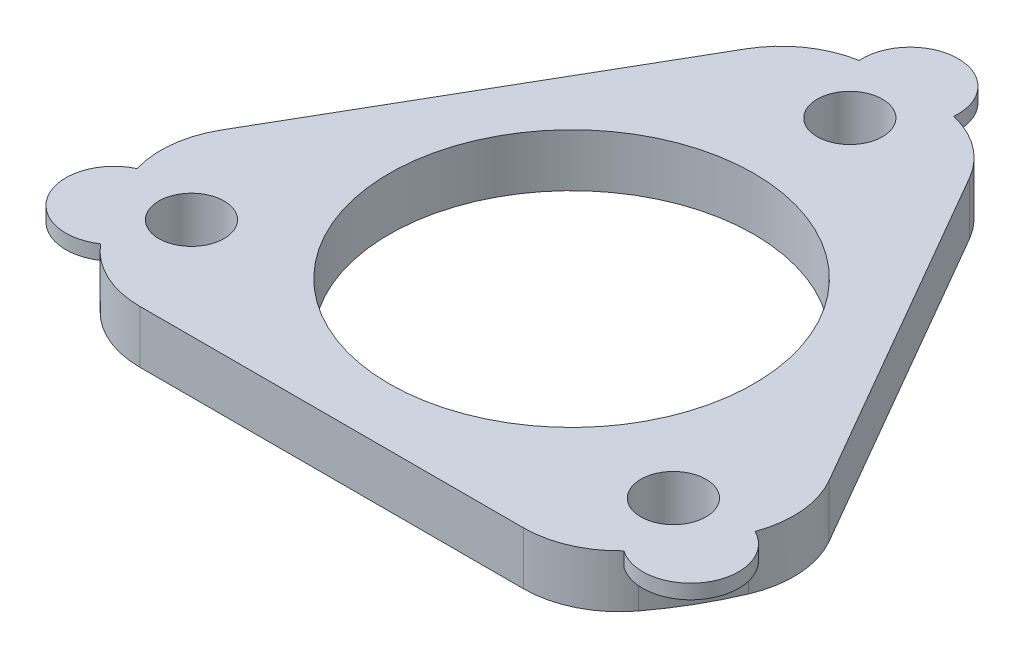
from build123d import *

# Parameters (mm, degrees)
SKETCH1_R                = 17.5
BOSS_EXTRUDE1_DEPTH      = 5.5
SKETCH2_R                = 35
SKETCH2_R_2              = 17.5
SKETCH2_R_3              = 2.8
BOSS_EXTRUDE2_DEPTH      = 5.5
BOSS_EXTRUDE3_DEPTH      = 2
BOSS_EXTRUDE3_DEPTH_BACK = 5.5
SKETCH4_R                = 2.9
SKETCH5_R                = 5
BOSS_EXTRUDE4_DEPTH      = 1.5
SKETCH3_R                = 17.5
CUT_EXTRUDE1_DEPTH       = 10
SKETCH12_R               = 72.135852014
CUT_EXTRUDE2_DEPTH       = 22
FILLET1_R                = 10
SKETCH13_R               = 3.4
CUT_EXTRUDE3_DEPTH       = 10
SKETCH14_R               = 19
CUT_EXTRUDE4_DEPTH       = 10


with BuildPart() as part:
    # Sketch1 → Boss-Extrude1 (new body)
    with BuildSketch(Plane(origin=(0, 0, 0), x_dir=(1, 0, 0), z_dir=(0, 1, 0))):
        with Locations(Location((0, 0, 0), (0, 0, 270))):
            Circle(SKETCH1_R)
    extrude(amount=BOSS_EXTRUDE1_DEPTH)

    # Sketch2 → Boss-Extrude2 (add)
    with BuildSketch(Plane(origin=(0, 0, 0), x_dir=(1, 0, 0), z_dir=(0, 1, 0))):
        with Locations(Location((0, 0, 0), (0, 0, 270))):
            Circle(SKETCH2_R)
        Circle(SKETCH2_R_2, mode=Mode.SUBTRACT)
        with Locations(Location((0, 29, 0), (0, 0, 270))):
            Circle(SKETCH2_R_3, mode=Mode.SUBTRACT)
        with Locations(Location((25.11473671, -14.5, 0), (0, 0, 270))):
            Circle(SKETCH2_R_3, mode=Mode.SUBTRACT)
        with Locations(Location((-25.11473671, -14.5, 0), (0, 0, 270))):
            Circle(SKETCH2_R_3, mode=Mode.SUBTRACT)
    extrude(amount=BOSS_EXTRUDE2_DEPTH)

    # Sketch4 → Boss-Extrude3 (add, two sides: drawn at the far end of the back side and taken through both)
    with BuildSketch(Plane.XZ.offset(-BOSS_EXTRUDE3_DEPTH_BACK)):
        with Locations(Location((-25.11473671, 14.5, 0), (0, 0, 270))):
            Circle(SKETCH4_R)
        with Locations(Location((25.11473671, 14.5, 0), (0, 0, 270))):
            Circle(SKETCH4_R)
        with Locations(Location((0, -29, 0), (0, 0, 270))):
            Circle(SKETCH4_R)
    extrude(amount=BOSS_EXTRUDE3_DEPTH + BOSS_EXTRUDE3_DEPTH_BACK)

    # Sketch5 → Boss-Extrude4 (add)
    with BuildSketch(Plane(origin=(0, 5.5, 0), x_dir=(1, 0, 0), z_dir=(0, 1, 0))):
        with Locations((-30.453629482, -17.250404383)):
            Circle(SKETCH5_R)
        with Locations((0.28752632, 34.99881896)):
            Circle(SKETCH5_R)
        with Locations((30.166103162, -17.748414577)):
            Circle(SKETCH5_R)
    extrude(amount=-BOSS_EXTRUDE4_DEPTH)

    # Sketch3 → Cut-Extrude1 (cut)
    with BuildSketch(Plane(origin=(0, 5.5, 0), x_dir=(1, 0, 0), z_dir=(0, 1, 0))):
        with Locations(Location((0, 0, 0), (0, 0, 270))):
            Circle(SKETCH3_R)
    extrude(amount=-CUT_EXTRUDE1_DEPTH, mode=Mode.SUBTRACT)

    # Sketch12 → Cut-Extrude2 (cut)
    with BuildSketch(Plane(origin=(0, 5.5, 0), x_dir=(1, 0, 0), z_dir=(0, 1, 0))):
        Circle(SKETCH12_R)
        Polygon((0, 50), (-43.301270189, -25), (43.301270189, -25), align=None, mode=Mode.SUBTRACT)
    extrude(amount=-CUT_EXTRUDE2_DEPTH, mode=Mode.SUBTRACT)

    # Fillet1
    # the kernel refuses this fillet: 10 mm, written as the material it takes off along each edge
    with BuildSketch(Plane(origin=(-24.494897428, 18.7960859, 25), x_dir=(1, 0, 0), z_dir=(0, -1, 0))) as fillet1_piece_1_section:
        with BuildLine():
            CenterArc((4.494897428, -10), FILLET1_R, 90, 53.130102354)
            ThreePointArc((-3.505102572, -4), (-1.828638885, -1.933326291), (0, 0))
            Line((0, 0), (4.494897428, 0))
        make_face()
    fillet1_piece_1 = extrude(amount=32.0921718, mode=Mode.PRIVATE)
    fillet1_piece_1 = fillet1_piece_1 - Plane(origin=(-30.453629482, 4.75, 17.250404383), x_dir=(1, 0, 0), z_dir=(0, 1, 0)) * Cylinder(5, 83, mode=Mode.PRIVATE)
    add(fillet1_piece_1, mode=Mode.SUBTRACT)
    with BuildSketch(Plane(origin=(-24.494897428, 18.7960859, 25), x_dir=(1, 0, 0), z_dir=(0, -1, 0))) as fillet1_piece_2_section:
        with BuildLine():
            CenterArc((4.494897428, -10), FILLET1_R, 90, 53.130102354)
            ThreePointArc((-3.505102572, -4), (-1.828638885, -1.933326291), (0, 0))
            Line((0, 0), (4.494897428, 0))
        make_face()
    fillet1_piece_2 = extrude(amount=32.0921718, mode=Mode.PRIVATE)
    fillet1_piece_2 = split(fillet1_piece_2, bisect_by=Plane(origin=(-27.761621835, 4, 21.309124186), z_dir=(0, -1, 0)), keep=Keep.TOP, mode=Mode.PRIVATE)
    add(fillet1_piece_2, mode=Mode.SUBTRACT)
    with BuildSketch(Plane(origin=(24.494897428, 18.7960859, 25), x_dir=(-1, 0, 0), z_dir=(0, -1, 0))) as fillet1_piece_3_section:
        with BuildLine():
            CenterArc((4.494897428, 10), FILLET1_R, 216.869897646, 53.130102354)
            ThreePointArc((-3.505102572, 4), (-1.828638885, 1.933326291), (0, 0))
            Line((0, 0), (4.494897428, 0))
        make_face()
    fillet1_piece_3 = extrude(amount=32.0921718, mode=Mode.PRIVATE)
    fillet1_piece_3 = fillet1_piece_3 - Plane(origin=(30.166103162, 4.75, 17.748414577), x_dir=(1, 0, 0), z_dir=(0, 1, 0)) * Cylinder(5, 83, mode=Mode.PRIVATE)
    add(fillet1_piece_3, mode=Mode.SUBTRACT)
    with BuildSketch(Plane(origin=(24.494897428, 18.7960859, 25), x_dir=(-1, 0, 0), z_dir=(0, -1, 0))) as fillet1_piece_4_section:
        with BuildLine():
            CenterArc((4.494897428, 10), FILLET1_R, 216.869897646, 53.130102354)
            ThreePointArc((-3.505102572, 4), (-1.828638885, 1.933326291), (0, 0))
            Line((0, 0), (4.494897428, 0))
        make_face()
    fillet1_piece_4 = extrude(amount=32.0921718, mode=Mode.PRIVATE)
    fillet1_piece_4 = split(fillet1_piece_4, bisect_by=Plane(origin=(27.488157838, 4, 21.643747381), z_dir=(0, -1, 0)), keep=Keep.TOP, mode=Mode.PRIVATE)
    add(fillet1_piece_4, mode=Mode.SUBTRACT)
    with BuildSketch(Plane(origin=(-9.403186381, 18.7960859, -33.713203436), x_dir=(-0.5000000000000003, 0, 0.8660254037844386), z_dir=(0, -1, 0))) as fillet1_piece_5_section:
        with BuildLine():
            CenterArc((4.494897428, -10), FILLET1_R, 90, 53.130102354)
            ThreePointArc((-3.505102572, -4), (-1.828638885, -1.933326291), (0, 0))
            Line((0, 0), (4.494897428, 0))
        make_face()
    fillet1_piece_5 = extrude(amount=32.0921718, mode=Mode.PRIVATE)
    fillet1_piece_5 = fillet1_piece_5 - Plane(origin=(0.28752632, 4.75, -34.99881896), x_dir=(1, 0, 0), z_dir=(0, 1, 0)) * Cylinder(5, 83, mode=Mode.PRIVATE)
    add(fillet1_piece_5, mode=Mode.SUBTRACT)
    with BuildSketch(Plane(origin=(-9.403186381, 18.7960859, -33.713203436), x_dir=(-0.5000000000000003, 0, 0.8660254037844386), z_dir=(0, -1, 0))) as fillet1_piece_6_section:
        with BuildLine():
            CenterArc((4.494897428, -10), FILLET1_R, 90, 53.130102354)
            ThreePointArc((-3.505102572, -4), (-1.828638885, -1.933326291), (0, 0))
            Line((0, 0), (4.494897428, 0))
        make_face()
    fillet1_piece_6 = extrude(amount=32.0921718, mode=Mode.PRIVATE)
    fillet1_piece_6 = split(fillet1_piece_6, bisect_by=Plane(origin=(-4.57343196, 4, -34.696831852), z_dir=(0, -1, 0)), keep=Keep.TOP, mode=Mode.PRIVATE)
    add(fillet1_piece_6, mode=Mode.SUBTRACT)
    with BuildSketch(Plane(origin=(-33.898083809, 18.7960859, 8.713203436), x_dir=(0.32181469455231854, 0, 0.9468026734067654), z_dir=(0, -1, 0))) as fillet1_piece_7_section:
        with BuildLine():
            CenterArc((4.558658023, -9.971095222), FILLET1_R, 85.642603122, 53.130102354)
            Line((-2.962352352, -3.380617019), (0, 0))
            ThreePointArc((0, 0), (2.65921718, 0.101166725), (5.31843436, 0))
        make_face()
    fillet1_piece_7 = extrude(amount=32.0921718, mode=Mode.PRIVATE)
    fillet1_piece_7 = fillet1_piece_7 - Plane(origin=(-30.453629482, 4.75, 17.250404383), x_dir=(1, 0, 0), z_dir=(0, 1, 0)) * Cylinder(5, 86, mode=Mode.PRIVATE)
    add(fillet1_piece_7, mode=Mode.SUBTRACT)
    with BuildSketch(Plane(origin=(-33.898083809, 18.7960859, 8.713203436), x_dir=(0.32181469455231854, 0, 0.9468026734067654), z_dir=(0, -1, 0))) as fillet1_piece_8_section:
        with BuildLine():
            CenterArc((4.558658023, -9.971095222), FILLET1_R, 85.642603122, 53.130102354)
            Line((-2.962352352, -3.380617019), (0, 0))
            ThreePointArc((0, 0), (2.65921718, 0.101166725), (5.31843436, 0))
        make_face()
    fillet1_piece_8 = extrude(amount=32.0921718, mode=Mode.PRIVATE)
    fillet1_piece_8 = split(fillet1_piece_8, bisect_by=Plane(origin=(-32.488113984, 4, 12.9835693), z_dir=(0, -1, 0)), keep=Keep.TOP, mode=Mode.PRIVATE)
    add(fillet1_piece_8, mode=Mode.SUBTRACT)
    with BuildSketch(Plane(origin=(33.898083809, 18.7960859, 8.713203436), x_dir=(-0.5000000000000012, 0, -0.8660254037844382), z_dir=(0, -1, 0))) as fillet1_piece_9_section:
        with BuildLine():
            CenterArc((4.494897428, -10), FILLET1_R, 90, 53.130102354)
            ThreePointArc((-3.505102572, -4), (-1.828638885, -1.933326291), (0, 0))
            Line((0, 0), (4.494897428, 0))
        make_face()
    fillet1_piece_9 = extrude(amount=32.0921718, mode=Mode.PRIVATE)
    fillet1_piece_9 = fillet1_piece_9 - Plane(origin=(30.166103162, 4.75, 17.748414577), x_dir=(1, 0, 0), z_dir=(0, 1, 0)) * Cylinder(5, 83, mode=Mode.PRIVATE)
    add(fillet1_piece_9, mode=Mode.SUBTRACT)
    with BuildSketch(Plane(origin=(33.898083809, 18.7960859, 8.713203436), x_dir=(-0.5000000000000012, 0, -0.8660254037844382), z_dir=(0, -1, 0))) as fillet1_piece_10_section:
        with BuildLine():
            CenterArc((4.494897428, -10), FILLET1_R, 90, 53.130102354)
            ThreePointArc((-3.505102572, -4), (-1.828638885, -1.933326291), (0, 0))
            Line((0, 0), (4.494897428, 0))
        make_face()
    fillet1_piece_10 = extrude(amount=32.0921718, mode=Mode.PRIVATE)
    fillet1_piece_10 = split(fillet1_piece_10, bisect_by=Plane(origin=(32.335053795, 4, 13.387707666), z_dir=(0, -1, 0)), keep=Keep.TOP, mode=Mode.PRIVATE)
    add(fillet1_piece_10, mode=Mode.SUBTRACT)
    with BuildSketch(Plane(origin=(9.403186381, 18.7960859, -33.713203436), x_dir=(-0.9808625148174394, 0, -0.19470163590994477), z_dir=(0, -1, 0))) as fillet1_piece_11_section:
        with BuildLine():
            CenterArc((4.558658023, -9.971095222), FILLET1_R, 85.642603122, 53.130102354)
            Line((-2.962352352, -3.380617019), (0, 0))
            ThreePointArc((0, 0), (2.65921718, 0.101166725), (5.31843436, 0))
        make_face()
    fillet1_piece_11 = extrude(amount=32.0921718, mode=Mode.PRIVATE)
    fillet1_piece_11 = fillet1_piece_11 - Plane(origin=(0.28752632, 4.75, -34.99881896), x_dir=(1, 0, 0), z_dir=(0, 1, 0)) * Cylinder(5, 86, mode=Mode.PRIVATE)
    add(fillet1_piece_11, mode=Mode.SUBTRACT)
    with BuildSketch(Plane(origin=(9.403186381, 18.7960859, -33.713203436), x_dir=(-0.9808625148174394, 0, -0.19470163590994477), z_dir=(0, -1, 0))) as fillet1_piece_12_section:
        with BuildLine():
            CenterArc((4.558658023, -9.971095222), FILLET1_R, 85.642603122, 53.130102354)
            Line((-2.962352352, -3.380617019), (0, 0))
            ThreePointArc((0, 0), (2.65921718, 0.101166725), (5.31843436, 0))
        make_face()
    fillet1_piece_12 = extrude(amount=32.0921718, mode=Mode.PRIVATE)
    fillet1_piece_12 = split(fillet1_piece_12, bisect_by=Plane(origin=(4.999956146, 4, -34.627316681), z_dir=(0, -1, 0)), keep=Keep.TOP, mode=Mode.PRIVATE)
    add(fillet1_piece_12, mode=Mode.SUBTRACT)

    # Sketch13 → Cut-Extrude3 (cut)
    with BuildSketch(Plane(origin=(0, 5.5, 0), x_dir=(1, 0, 0), z_dir=(0, 1, 0))):
        with Locations(Location((0, 29, 0), (0, 0, 270))):
            Circle(SKETCH13_R)
        with Locations(Location((25.11473671, -14.5, 0), (0, 0, 270))):
            Circle(SKETCH13_R)
        with Locations(Location((-25.11473671, -14.5, 0), (0, 0, 270))):
            Circle(SKETCH13_R)
    extrude(amount=-CUT_EXTRUDE3_DEPTH, mode=Mode.SUBTRACT)

    # Sketch14 → Cut-Extrude4 (cut)
    with BuildSketch(Plane(origin=(0, 5.5, 0), x_dir=(1, 0, 0), z_dir=(0, 1, 0))):
        with Locations(Location((0, 0, 0), (0, 0, 270))):
            Circle(SKETCH14_R)
    extrude(amount=-CUT_EXTRUDE4_DEPTH, mode=Mode.SUBTRACT)


solid = part.part
